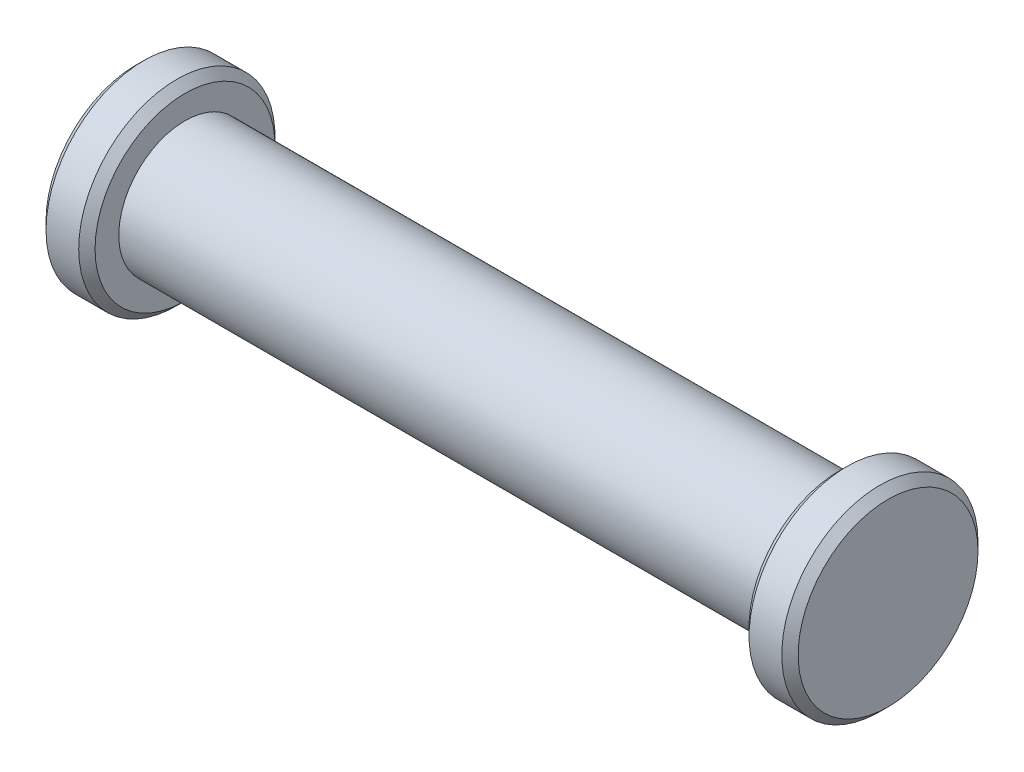
from build123d import *

# Parameters (mm, degrees)
SKETCH1_R           = 4.05
BOSS_EXTRUDE1_DEPTH = 40
SKETCH2_R           = 6
BOSS_EXTRUDE2_DEPTH = 3
BOSS_EXTRUDE3_START = 3
SKETCH4_R           = 6
BOSS_EXTRUDE3_DEPTH = 3
CHAMFER2_SIZE       = 0.5


with BuildPart() as part:
    # Sketch1 → Boss-Extrude1 (new body)
    with BuildSketch(Plane(origin=(0, 0, 0), x_dir=(0, 0, -1), z_dir=(1, 0, 0))):
        Circle(SKETCH1_R)
    extrude(amount=BOSS_EXTRUDE1_DEPTH)

    # Sketch2 → Boss-Extrude2 (add)
    with BuildSketch(Plane(origin=(40, 0, 0), x_dir=(0, 0, -1), z_dir=(1, 0, 0))):
        Circle(SKETCH2_R)
    extrude(amount=BOSS_EXTRUDE2_DEPTH)

    # Sketch4 → Boss-Extrude3 (add)
    with BuildSketch(Plane.ZY.offset(BOSS_EXTRUDE3_START)):
        Circle(SKETCH4_R)
    extrude(amount=-BOSS_EXTRUDE3_DEPTH)

    # Chamfer2
    chamfer2_edges = [part.edges().sort_by_distance(p)[0] for p in [
        (43, 0, 6),
        (40, 0, 6),
        (0, 0, -6),
        (-3, 0, -6),
    ]]
    chamfer(chamfer2_edges, length=CHAMFER2_SIZE)


solid = part.part
